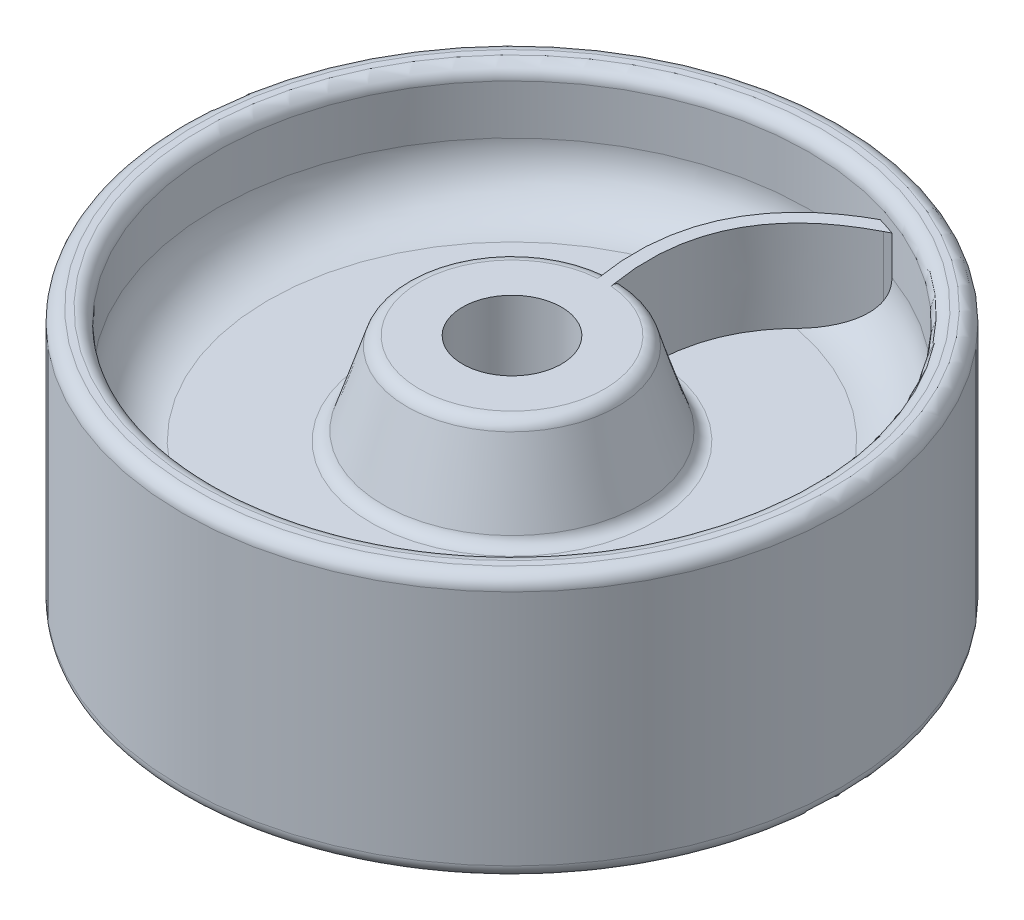
from build123d import *

# Parameters (mm, degrees)
FILLET1_R         = 2.54
FILLET2_R         = 2.54
FILLET3_R         = 10.16
RIB1_START        = -19
RIB1_OUTLINE_R    = 9.525
RIB1_DEPTH        = 19
MIRROR1_START     = -20.763961415
MIRROR1_OUTLINE_R = 9.525
MIRROR1_DEPTH     = 18.763961415


with BuildPart() as part:
    # Sketch1 → Revolve1 (revolve)
    with BuildSketch(Plane.XY, mode=Mode.PRIVATE) as revolve1_sk:
        Polygon((-9.525, -20.763961415), (-9.525, 20.763961415), (-19.685, 20.763961415), (-25.4, 3.175), (-57.15, 3.175), (-57.15, 25.4), (-63.5, 25.4), (-63.5, -25.4), (-57.15, -25.4), (-57.15, -3.175), (-25.4, -3.175), (-19.685, -20.763961415), align=None)
    revolve(revolve1_sk.sketch.rotate(Axis((0, 0, 0), (0, 1, 0)), 270), axis=Axis((0, 0, 0), (0, 1, 0)))

    # Fillet1
    fillet1_edges = [part.edges().sort_by_distance(p)[0] for p in [
        (0, 20.763961415, 19.685),
        (0, -20.763961415, 19.685),
        (0, -25.4, 57.15),
        (0, -25.4, 63.5),
        (0, 25.4, 63.5),
        (0, 25.4, 57.15),
    ]]
    fillet(fillet1_edges, radius=FILLET1_R)

    # Fillet2
    fillet2_edges = [part.edges().sort_by_distance(p)[0] for p in [
        (0, 3.175, 25.4),
        (0, -3.175, 25.4),
    ]]
    fillet(fillet2_edges, radius=FILLET2_R)

    # Fillet3
    fillet3_edges = [part.edges().sort_by_distance(p)[0] for p in [
        (0, -3.175, 57.15),
        (0, 3.175, 57.15),
    ]]
    fillet(fillet3_edges, radius=FILLET3_R)


with BuildPart() as rib1_tool:
    # Rib1: read off the stored shape, not the designer's step
    # Rib1 outline → Rib1 (new body)
    with BuildSketch(Plane(origin=(0, 20.763961415, 0), x_dir=(1, 0, 0), z_dir=(0, 1, 0)).offset(RIB1_START)):
        with BuildLine():
            add(Edge.make_bspline(
                [(-1.281120442, 17.793521947), (-1.36241808, 18.264345609), (-1.437597202, 18.73624901), (-1.58182972, 19.729626207), (-1.649500967, 20.251300129), (-1.766799342, 21.286444073), (-1.81675088, 21.799877052), (-1.898550317, 22.818520964), (-1.930719576, 23.323705913), (-1.976898704, 24.325832865), (-1.991224042, 24.822760132), (-2.001659181, 25.808339056), (-1.998075544, 26.296987279), (-1.972639264, 27.265964757), (-1.951080994, 27.746301562), (-1.889646245, 28.698600915), (-1.850048503, 29.170581282), (-1.752492182, 30.106100361), (-1.694793185, 30.569665996), (-1.561000666, 31.48827625), (-1.485144092, 31.943355255), (-1.315014138, 32.844901732), (-1.220951759, 33.29140892), (-1.014401654, 34.175711575), (-0.902095992, 34.613549487), (-0.659066561, 35.480405912), (-0.528493387, 35.909466589), (-0.248953478, 36.758656224), (-0.100103944, 37.178823728), (0.215946015, 38.010113445), (0.383063841, 38.421267043), (0.735589624, 39.234417846), (0.920949991, 39.636435676), (1.309882971, 40.43121013), (1.513442569, 40.823973121), (1.938680907, 41.600142992), (2.160379937, 41.983538752), (2.621791535, 42.740892308), (2.861555651, 43.114818687), (3.358982679, 43.853167118), (3.616725669, 44.217535194), (4.149990309, 44.93671771), (4.425617299, 45.291453991), (4.994528247, 45.991341286), (5.287939157, 46.336389028), (5.892298375, 47.016884999), (6.203391377, 47.352204611), (6.843000599, 48.013246361), (7.171675334, 48.338814976), (7.846341926, 48.980371315), (8.192502293, 49.296181646), (8.902044172, 49.91825038), (9.265600585, 50.224309061), (10.009849986, 50.826913416), (10.390720974, 51.123238985), (11.169527202, 51.706423563), (11.567640632, 51.993044313), (12.380871139, 52.556870804), (12.796164087, 52.833822536), (13.643706766, 53.378365788), (14.076128006, 53.645690038), (14.957884239, 54.171033435), (15.407384581, 54.428774506), (15.950164557, 54.728776064), (16.039658408, 54.777879589), (16.129301478, 54.826709139)],
                knots=[0.176672431, 0.176672431, 0.176672431, 0.176672431, 1.610022378, 1.610022378, 3.187908387, 3.187908387, 4.735201561, 4.735201561, 6.253532859, 6.253532859, 7.744621378, 7.744621378, 9.210274121, 9.210274121, 10.652384723, 10.652384723, 12.072931025, 12.072931025, 13.47397145, 13.47397145, 14.857640163, 14.857640163, 16.226141044, 16.226141044, 17.581740544, 17.581740544, 18.926759551, 18.926759551, 20.263564394, 20.263564394, 21.594557152, 21.594557152, 22.922165442, 22.922165442, 24.248831839, 24.248831839, 25.57700309, 25.57700309, 26.90911928, 26.90911928, 28.247603072, 28.247603072, 29.594849207, 29.594849207, 30.953214389, 30.953214389, 32.325007747, 32.325007747, 33.712482015, 33.712482015, 35.117825622, 35.117825622, 36.543155792, 36.543155792, 37.990512783, 37.990512783, 39.461855334, 39.461855334, 40.959057311, 40.959057311, 42.483905559, 42.483905559, 44.038098871, 44.038098871, 44.344321089, 44.344321089, 44.344321089, 44.344321089], degree=3))
            ThreePointArc((-1.281120442, 17.793521947), (-0.008377403, -17.839580012), (1.297833571, 17.792310508))
            Line((1.297833571, 17.792310508), (1.250780481, 18.059691468))
            add(Edge.make_bspline(
                [(1.250780481, 18.059691468), (1.162180864, 18.563221601), (1.080858871, 19.06806851), (0.935627348, 20.068317242), (0.871358142, 20.563666996), (0.760166229, 21.544925056), (0.712882536, 22.030792128), (0.635609256, 22.993070967), (0.60525957, 23.469453606), (0.561790818, 24.412763646), (0.548315723, 24.879674402), (0.538528614, 25.80404854), (0.541868095, 26.261508007), (0.565637826, 27.166998821), (0.585730968, 27.615038802), (0.642932724, 28.501722242), (0.6797198, 28.940386245), (0.770232812, 29.808363036), (0.823657163, 30.237707094), (0.947368995, 31.087103819), (1.017379301, 31.507196699), (1.174190691, 32.338165727), (1.260743364, 32.749088623), (1.45057324, 33.561806825), (1.553634848, 33.963652388), (1.776425228, 34.758318446), (1.895974754, 35.15118912), (2.151695131, 35.928019399), (2.287725888, 36.312025073), (2.576376695, 37.071248162), (2.72889769, 37.446503213), (3.050512475, 38.188353371), (3.21954907, 38.554973266), (3.574195076, 39.279683169), (3.75978883, 39.637780839), (4.147565841, 40.345574119), (4.349773506, 40.695256355), (4.770810961, 41.386340476), (4.989702678, 41.727704618), (5.444155253, 42.402264606), (5.679812081, 42.735395763), (6.167854083, 43.393589235), (6.420365059, 43.718558206), (6.94218407, 44.360511977), (7.211643038, 44.677373991), (7.76743332, 45.303182402), (8.053935753, 45.611976685), (8.643891884, 46.221701581), (8.947531928, 46.522451704), (9.571843062, 47.116123898), (9.89271096, 47.408838771), (10.551556019, 47.986460682), (10.889736043, 48.271136052), (11.583279956, 48.832685183), (11.938848828, 49.109305457), (12.667240059, 49.654738359), (13.040266124, 49.923278591), (13.803634684, 50.452534987), (14.194176765, 50.71296287), (14.992635462, 51.225969733), (15.400745313, 51.478247569), (16.234383012, 51.974922714), (16.660095822, 52.219008932), (17.529005188, 52.699264968), (17.972377839, 52.935116507), (18.419148644, 53.164262044)],
                knots=[0, 0, 0, 0, 1.533795121, 1.533795121, 3.032064893, 3.032064893, 4.496288826, 4.496288826, 5.928057721, 5.928057721, 7.329079506, 7.329079506, 8.701184301, 8.701184301, 10.04632838, 10.04632838, 11.366596638, 11.366596638, 12.664203136, 12.664203136, 13.941489321, 13.941489321, 15.200919509, 15.200919509, 16.445073345, 16.445073345, 17.676635037, 17.676635037, 18.898379348, 18.898379348, 20.113154532, 20.113154532, 21.323862622, 21.323862622, 22.533437668, 22.533437668, 23.744822724, 23.744822724, 24.960946477, 24.960946477, 26.184700447, 26.184700447, 27.418917632, 27.418917632, 28.666353359, 28.666353359, 29.929668892, 29.929668892, 31.211418167, 31.211418167, 32.514037774, 32.514037774, 33.839840134, 33.839840134, 35.191009646, 35.191009646, 36.569601475, 36.569601475, 37.977542581, 37.977542581, 39.416634561, 39.416634561, 40.888557901, 40.888557901, 42.394877251, 42.394877251, 42.394877251, 42.394877251], degree=3))
            Line((18.419148644, 53.164262044), (19.501962377, 53.719605019))
            ThreePointArc((19.501962377, 53.719605019), (17.824229325, 54.299349434), (16.129301478, 54.826709139))
        make_face()
        Circle(RIB1_OUTLINE_R, mode=Mode.SUBTRACT)
    extrude(amount=RIB1_DEPTH)


with BuildPart() as part_1:
    add(part.part)


with BuildPart() as part_2:
    # Rib1: joined with rib1_tool
    add(part_1.part.fuse(rib1_tool.part, tol=0.00001))

    # Mirror1: read off the stored shape, not the designer's step
    # Mirror1 outline → Mirror1 (add)
    with BuildSketch(Plane(origin=(0, 0, 0), x_dir=(1, 0, 0), z_dir=(0, 1, 0)).offset(MIRROR1_START)):
        with BuildLine():
            ThreePointArc((-1.281122592, 17.793521576), (-0.008377403, -17.839580012), (1.297833571, 17.792310508))
            Line((1.297833571, 17.792310508), (1.250780481, 18.059691468))
            add(Edge.make_bspline(
                [(1.250780481, 18.059691468), (1.162180864, 18.563221601), (1.080858871, 19.06806851), (0.935627348, 20.068317242), (0.871358142, 20.563666996), (0.760166229, 21.544925056), (0.712882536, 22.030792128), (0.635609256, 22.993070967), (0.60525957, 23.469453606), (0.561790818, 24.412763646), (0.548315723, 24.879674402), (0.538528614, 25.80404854), (0.541868095, 26.261508007), (0.565637826, 27.166998821), (0.585730968, 27.615038802), (0.642932724, 28.501722242), (0.6797198, 28.940386245), (0.770232812, 29.808363036), (0.823657163, 30.237707094), (0.947368995, 31.087103819), (1.017379301, 31.507196699), (1.174190691, 32.338165727), (1.260743364, 32.749088623), (1.45057324, 33.561806825), (1.553634848, 33.963652388), (1.776425228, 34.758318446), (1.895974754, 35.15118912), (2.151695131, 35.928019399), (2.287725888, 36.312025073), (2.576376695, 37.071248162), (2.72889769, 37.446503213), (3.050512475, 38.188353371), (3.21954907, 38.554973266), (3.574195076, 39.279683169), (3.75978883, 39.637780839), (4.147565841, 40.345574119), (4.349773506, 40.695256355), (4.770810961, 41.386340476), (4.989702678, 41.727704618), (5.444155253, 42.402264606), (5.679812081, 42.735395763), (6.167854083, 43.393589235), (6.420365059, 43.718558206), (6.94218407, 44.360511977), (7.211643038, 44.677373991), (7.76743332, 45.303182402), (8.053935753, 45.611976685), (8.643891884, 46.221701581), (8.947531928, 46.522451704), (9.571843062, 47.116123898), (9.89271096, 47.408838771), (10.551556019, 47.986460682), (10.889736043, 48.271136052), (11.583279956, 48.832685183), (11.938848828, 49.109305457), (12.667240059, 49.654738359), (13.040266124, 49.923278591), (13.803634684, 50.452534987), (14.194176765, 50.71296287), (14.992635462, 51.225969733), (15.400745313, 51.478247569), (16.234383012, 51.974922714), (16.660095822, 52.219008932), (17.529005188, 52.699264968), (17.972377839, 52.935116507), (18.419148644, 53.164262044)],
                knots=[0, 0, 0, 0, 1.533795121, 1.533795121, 3.032064893, 3.032064893, 4.496288826, 4.496288826, 5.928057721, 5.928057721, 7.329079506, 7.329079506, 8.701184301, 8.701184301, 10.04632838, 10.04632838, 11.366596638, 11.366596638, 12.664203136, 12.664203136, 13.941489321, 13.941489321, 15.200919509, 15.200919509, 16.445073345, 16.445073345, 17.676635037, 17.676635037, 18.898379348, 18.898379348, 20.113154532, 20.113154532, 21.323862622, 21.323862622, 22.533437668, 22.533437668, 23.744822724, 23.744822724, 24.960946477, 24.960946477, 26.184700447, 26.184700447, 27.418917632, 27.418917632, 28.666353359, 28.666353359, 29.929668892, 29.929668892, 31.211418167, 31.211418167, 32.514037774, 32.514037774, 33.839840134, 33.839840134, 35.191009646, 35.191009646, 36.569601475, 36.569601475, 37.977542581, 37.977542581, 39.416634561, 39.416634561, 40.888557901, 40.888557901, 42.394877251, 42.394877251, 42.394877251, 42.394877251], degree=3))
            Line((18.419148644, 53.164262044), (19.501962377, 53.719605019))
            ThreePointArc((19.501962377, 53.719605019), (17.824229325, 54.299349434), (16.129300893, 54.826710212))
            add(Edge.make_bspline(
                [(-1.281122592, 17.793521576), (-1.36241808, 18.264345609), (-1.437597202, 18.73624901), (-1.58182972, 19.729626207), (-1.649500967, 20.251300129), (-1.766799342, 21.286444073), (-1.81675088, 21.799877052), (-1.898550317, 22.818520964), (-1.930719576, 23.323705913), (-1.976898704, 24.325832865), (-1.991224042, 24.822760132), (-2.001659181, 25.808339056), (-1.998075544, 26.296987279), (-1.972639264, 27.265964757), (-1.951080994, 27.746301562), (-1.889646245, 28.698600915), (-1.850048503, 29.170581282), (-1.752492182, 30.106100361), (-1.694793185, 30.569665996), (-1.561000666, 31.48827625), (-1.485144092, 31.943355255), (-1.315014138, 32.844901732), (-1.220951759, 33.29140892), (-1.014401654, 34.175711575), (-0.902095992, 34.613549487), (-0.659066561, 35.480405912), (-0.528493387, 35.909466589), (-0.248953478, 36.758656224), (-0.100103944, 37.178823728), (0.215946015, 38.010113445), (0.383063841, 38.421267043), (0.735589624, 39.234417846), (0.920949991, 39.636435676), (1.309882971, 40.43121013), (1.513442569, 40.823973121), (1.938680907, 41.600142992), (2.160379937, 41.983538752), (2.621791535, 42.740892308), (2.861555651, 43.114818687), (3.358982679, 43.853167118), (3.616725669, 44.217535194), (4.149990309, 44.93671771), (4.425617299, 45.291453991), (4.994528247, 45.991341286), (5.287939157, 46.336389028), (5.892298375, 47.016884999), (6.203391377, 47.352204611), (6.843000599, 48.013246361), (7.171675334, 48.338814976), (7.846341926, 48.980371315), (8.192502293, 49.296181646), (8.902044172, 49.91825038), (9.265600585, 50.224309061), (10.009849986, 50.826913416), (10.390720974, 51.123238985), (11.169527202, 51.706423563), (11.567640632, 51.993044313), (12.380871139, 52.556870804), (12.796164087, 52.833822536), (13.643706766, 53.378365788), (14.076128006, 53.645690038), (14.957884239, 54.171033435), (15.407384581, 54.428774506), (15.950164557, 54.728776064), (16.039658408, 54.777879589), (16.129300893, 54.826710212)],
                knots=[0.176672431, 0.176672431, 0.176672431, 0.176672431, 1.610022378, 1.610022378, 3.187908387, 3.187908387, 4.735201561, 4.735201561, 6.253532859, 6.253532859, 7.744621378, 7.744621378, 9.210274121, 9.210274121, 10.652384723, 10.652384723, 12.072931025, 12.072931025, 13.47397145, 13.47397145, 14.857640163, 14.857640163, 16.226141044, 16.226141044, 17.581740544, 17.581740544, 18.926759551, 18.926759551, 20.263564394, 20.263564394, 21.594557152, 21.594557152, 22.922165442, 22.922165442, 24.248831839, 24.248831839, 25.57700309, 25.57700309, 26.90911928, 26.90911928, 28.247603072, 28.247603072, 29.594849207, 29.594849207, 30.953214389, 30.953214389, 32.325007747, 32.325007747, 33.712482015, 33.712482015, 35.117825622, 35.117825622, 36.543155792, 36.543155792, 37.990512783, 37.990512783, 39.461855334, 39.461855334, 40.959057311, 40.959057311, 42.483905559, 42.483905559, 44.038098871, 44.038098871, 44.344321089, 44.344321089, 44.344321089, 44.344321089], degree=3))
        make_face()
        Circle(MIRROR1_OUTLINE_R, mode=Mode.SUBTRACT)
    extrude(amount=MIRROR1_DEPTH)


solid = part_2.part
